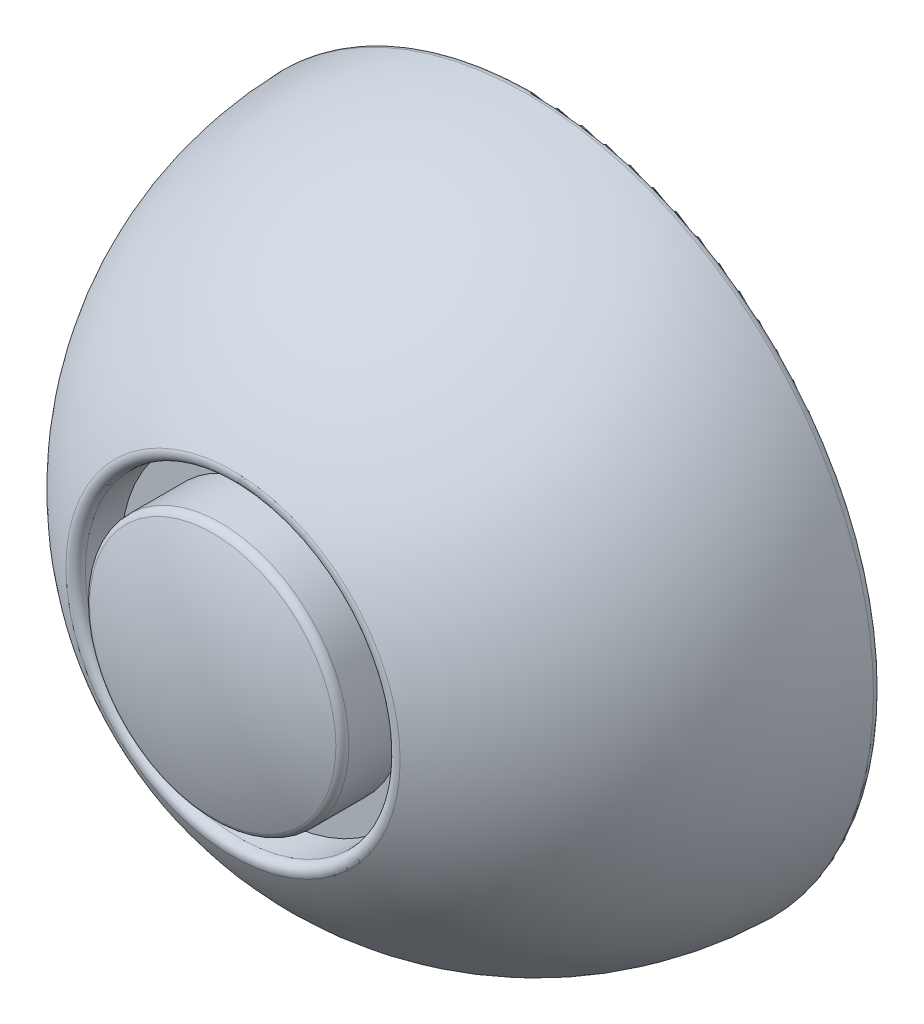
from build123d import *

# Parameters (mm, degrees)
FILLET1_R = 0.25


with BuildPart() as part:
    # Sketch2 → Main Body (revolve)
    with BuildSketch(Plane(origin=(0, 0, 0), x_dir=(1, 0, 0), z_dir=(0, 1, 0)), mode=Mode.PRIVATE) as main_body_sk:
        with BuildLine():
            Line((6.84582309418425, -7.289355675444402), (1.5999999999999999, -7.289355675444404))
            Line((1.5999999999999999, -7.289355675444404), (1.5999999999999999, -8.289355675444403))
            Line((1.5999999999999999, -8.289355675444403), (0, -9.500000000000002))
            Line((0, -9.500000000000002), (0, -10.5))
            ThreePointArc((0, -10.5), (1.985839381922277, -10.310501537229241), (3.9000000000000004, -9.748846085563152))
            Line((3.9000000000000004, -9.748846085563152), (3.9000000000000004, -7.889355675444406))
            Line((3.9000000000000004, -7.889355675444406), (4.7, -7.8893556754444045))
            Line((4.7, -7.8893556754444045), (4.7, -9.389355675444403))
            ThreePointArc((4.7, -9.389355675444403), (8.933084573650918, -5.5181518645285585), (10.5, 0))
            Line((10.5, 0), (10, 0))
            ThreePointArc((10, 0), (9.177642152041082, -3.9712572982720147), (6.84582309418425, -7.289355675444402))
        make_face()
    revolve(main_body_sk.sketch.rotate(Axis((0, 0, 0), (0, 0, 1)), 180), axis=Axis((0, 0, 0), (0, 0, 1)))

    # Fillet1
    # the kernel refuses this fillet: 0.25 mm, written as the material it takes off along each edge
    with BuildSketch(Plane(origin=(0, 0, 7.289355675444404), x_dir=(-1, 1.2e-16, 0), z_dir=(1.2e-16, 1, 0))) as fillet1_piece_1:
        with BuildLine():
            CenterArc((1.5999999999999999 + FILLET1_R, FILLET1_R), FILLET1_R, 179.9999999999996, 90.0000000000004)
            Line((1.5999999999999999, FILLET1_R), (1.5999999999999999, 0))
            Line((1.5999999999999999, 0), (1.5999999999999999 + FILLET1_R, -1.78e-15))
        make_face()
    revolve(axis=Axis((0, 0, 7.289355675444404), (0, 0, 1)), mode=Mode.SUBTRACT)
    with BuildSketch(Plane(origin=(0, 0, 0), x_dir=(-1, 1.2e-16, 0), z_dir=(1.2e-16, 1, 0))) as fillet1_piece_2:
        with BuildLine():
            CenterArc((10.246950765959598, 0.25), FILLET1_R, 181.39759662824545, 88.60240337175458)
            ThreePointArc((9.99702513752156, 0.24390243902439043), (9.999256256722687, 0.12196029022679075), (10, 0))
            Line((10, 0), (10.246950765959598, 0))
        make_face()
    revolve(axis=Axis((0, 0, 0), (0, 0, 1)), mode=Mode.SUBTRACT)
    with BuildSketch(Plane(origin=(0, 0, 5.6e-16), x_dir=(-1, 1.2e-16, 0), z_dir=(1.2e-16, 1, 0))) as fillet1_piece_3:
        with BuildLine():
            CenterArc((10.246950765959598, 0.24999999999999944), FILLET1_R, 270.0000000000004, 91.39759662824514)
            Line((10.2469507659596, -5.6e-16), (10.5, 0))
            ThreePointArc((10.5, 0), (10.499219069558821, 0.12805830473812999), (10.496876394397637, 0.2560975609756094))
        make_face()
    revolve(axis=Axis((0, 0, 5.6e-16), (0, 0, 1)), mode=Mode.SUBTRACT)
    with BuildSketch(Plane(origin=(0, 0, 9.389355675444403), x_dir=(-1, 1.2e-16, 0), z_dir=(1.2e-16, 1, 0))) as fillet1_piece_4:
        with BuildLine():
            CenterArc((4.95, -0.41383340651612777), FILLET1_R, 61.12326703097314, 118.87673296902688)
            ThreePointArc((5.070731707317046, -0.19491822922521607), (4.8863378723857025, -0.0956103487803901), (4.700000000000001, 0))
            Line((4.700000000000001, 0), (4.7, -0.41383340651612777))
        make_face()
    revolve(axis=Axis((0, 0, 9.389355675444403), (0, 0, 1)), mode=Mode.SUBTRACT)
    with BuildSketch(Plane(origin=(0, 0, 9.748846085563152), x_dir=(-1, 1.2e-16, 0), z_dir=(1.2e-16, 1, 0))) as fillet1_piece_5:
        with BuildLine():
            CenterArc((3.649999999999999, -0.17074606520420765), FILLET1_R, 4.0711e-13, 69.13927364542349)
            Line((3.899999999999999, -0.17074606520420588), (3.9000000000000004, 0))
            ThreePointArc((3.9000000000000004, 0), (3.8196415337402567, 0.03176425089982082), (3.739024390243901, 0.062866130414303))
        make_face()
    revolve(axis=Axis((0, 0, 9.748846085563152), (0, 0, 1)), mode=Mode.SUBTRACT)


solid = part.part
